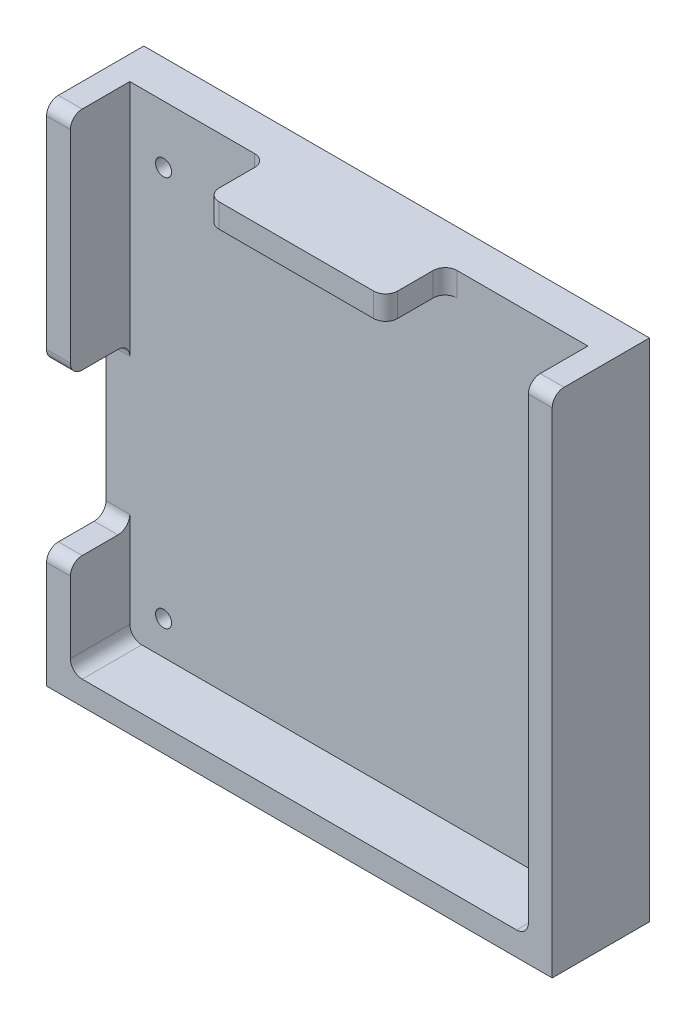
from build123d import *

# Parameters (mm, degrees)
SKETCH1_W           = 85
SKETCH1_H           = 85
SKETCH1_R           = 1.35
BOSS_EXTRUDE1_DEPTH = 6.35
SKETCH2_W           = 4
SKETCH2_H           = 38
SKETCH2_W_2         = 30
SKETCH2_H_2         = 4
BOSS_EXTRUDE3_DEPTH = 10
FILLET1_R           = 2


with BuildPart() as part:
    # Sketch1 → Boss-Extrude1 (new body)
    with BuildSketch(Plane.XY):
        Rectangle(SKETCH1_W, SKETCH1_H)
        with Locations((-32.83, 32.83)):
            Circle(SKETCH1_R, mode=Mode.SUBTRACT)
        with Locations((-32.83, -32.83)):
            Circle(SKETCH1_R, mode=Mode.SUBTRACT)
        with Locations((32.83, 32.83)):
            Circle(SKETCH1_R, mode=Mode.SUBTRACT)
        with Locations((32.83, -32.83)):
            Circle(SKETCH1_R, mode=Mode.SUBTRACT)
    extrude(amount=BOSS_EXTRUDE1_DEPTH)

    # Sketch2 → Boss-Extrude3 (add)
    with BuildSketch(Plane.XY.offset(6.35)):
        with Locations((-40.5, 23.5)):
            Rectangle(SKETCH2_W, SKETCH2_H)
        with Locations((-0.5, 40.5)):
            Rectangle(SKETCH2_W_2, SKETCH2_H_2)
        Polygon((-38.5, -22.5), (-42.5, -22.5), (-42.5, -42.5), (42.5, -42.5), (42.5, 42.5), (38.5, 42.5), (38.5, -38.5), (-38.5, -38.5), align=None)
    extrude(amount=BOSS_EXTRUDE3_DEPTH)

    # Fillet1
    fillet1_edges = [part.edges().sort_by_distance(p)[0] for p in [
        (-40.5, -22.5, 16.35),
        (-40.5, 4.5, 16.35),
        (-40.5, 42.5, 16.35),
        (40.5, 42.5, 16.35),
        (14.5, 40.5, 16.35),
        (-15.5, 40.5, 16.35),
        (-38.5, -38.5, 11.35),
        (38.5, -38.5, 11.35),
        (14.5, 40.5, 6.35),
        (-15.5, 40.5, 6.35),
        (-40.5, -22.5, 6.35),
        (-40.5, 4.5, 6.35),
    ]]
    fillet(fillet1_edges, radius=FILLET1_R)


solid = part.part
